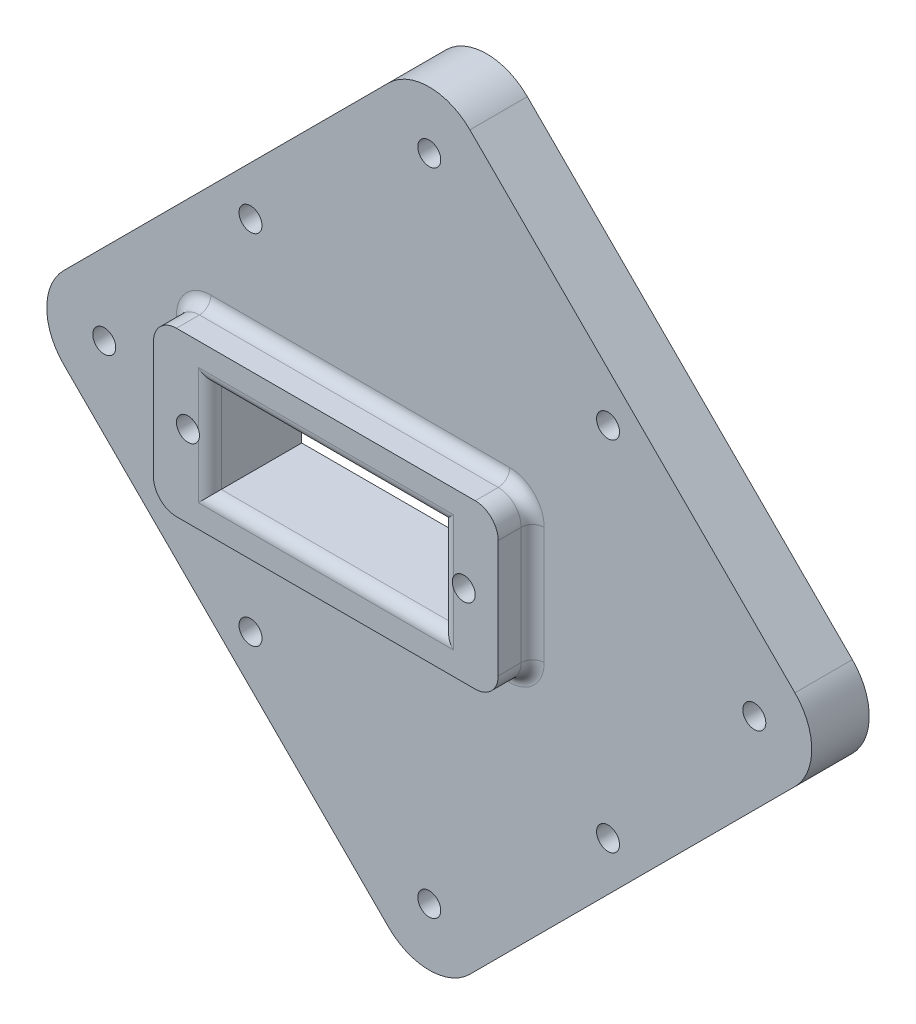
from build123d import *

# Parameters (mm, degrees)
SKETCH1_W           = 60
SKETCH1_H           = 60
BOSS_EXTRUDE1_DEPTH = 5
SKETCH2_W           = 30
SKETCH2_H           = 14.2
SKETCH2_W_2         = 20.2
SKETCH2_H_2         = 8.2
BOSS_EXTRUDE2_DEPTH = 3
SKETCH3_W           = 20.2
SKETCH3_H           = 8.2
CUT_EXTRUDE1_DEPTH  = 15
SKETCH5_R           = 1
CUT_EXTRUDE2_DEPTH  = 15
FILLET1_R           = 2
SKETCH6_W           = 120.017280655
SKETCH6_H           = 101.423054075
CUT_EXTRUDE3_DEPTH  = 15
BOSS_EXTRUDE3_DEPTH = 5
CUT_EXTRUDE4_DEPTH  = 15
FILLET3_R           = 5
SKETCH9_R           = 1
CUT_EXTRUDE5_DEPTH  = 15
SKETCH10_R          = 1
CUT_EXTRUDE6_DEPTH  = 10
FILLET4_R           = 1


with BuildPart() as part:
    # Sketch1 → Boss-Extrude1 (new body)
    with BuildSketch(Plane.XY):
        with Locations((30, 30)):
            Rectangle(SKETCH1_W, SKETCH1_H)
    extrude(amount=BOSS_EXTRUDE1_DEPTH)

    # Sketch2 → Boss-Extrude2 (add)
    with BuildSketch(Plane.XY.offset(5)):
        with Locations((24, 30)):
            Rectangle(SKETCH2_W, SKETCH2_H)
        with Locations((24, 30)):
            Rectangle(SKETCH2_W_2, SKETCH2_H_2, mode=Mode.SUBTRACT)
    extrude(amount=BOSS_EXTRUDE2_DEPTH)

    # Sketch3 → Cut-Extrude1 (cut)
    with BuildSketch(Plane.XY.offset(5)):
        with Locations((24, 30)):
            Rectangle(SKETCH3_W, SKETCH3_H)
    extrude(amount=-CUT_EXTRUDE1_DEPTH, mode=Mode.SUBTRACT)

    # Sketch5 → Cut-Extrude2 (cut)
    with BuildSketch(Plane.XY.offset(8)):
        with Locations((12, 30)):
            Circle(SKETCH5_R)
        with Locations((36, 30)):
            Circle(SKETCH5_R)
    extrude(amount=-CUT_EXTRUDE2_DEPTH, mode=Mode.SUBTRACT)

    # Fillet1
    fillet1_edges = [part.edges().sort_by_distance(p)[0] for p in [
        (39, 22.9, 6.5),
        (39, 37.1, 6.5),
        (9, 37.1, 6.5),
        (9, 22.9, 6.5),
        (0, 0, 2.5),
        (0, 60, 2.5),
        (60, 60, 2.5),
        (60, 0, 2.5),
    ]]
    fillet(fillet1_edges, radius=FILLET1_R)

    # Sketch6 → Cut-Extrude3 (cut)
    with BuildSketch(Plane(origin=(0, 0, 0), x_dir=(-1, 0, 0), z_dir=(0, 0, -1))):
        with Locations((-31.690384235, 31.655167897)):
            Rectangle(SKETCH6_W, SKETCH6_H)
        Polygon((-8.786796564, 51.213203436), (12.426406871, 30), (-30, -12.426406871), (-72.426406871, 30), (-30, 72.426406871), align=None, mode=Mode.SUBTRACT)
    extrude(amount=-CUT_EXTRUDE3_DEPTH, mode=Mode.SUBTRACT)

    # Sketch7 → Boss-Extrude3 (add)
    with BuildSketch(Plane(origin=(0, 0, 0), x_dir=(-1, 0, 0), z_dir=(0, 0, -1))):
        Polygon((-8.786796564, 51.213203436), (12.426406871, 30), (-30, -12.426406871), (-72.426406871, 30), (-30, 72.426406871), align=None)
        Polygon((-19.393398282, 40.606601718), (-8.786796564, 30), (-30, 8.786796564), (-51.213203436, 30), (-30, 51.213203436), align=None, mode=Mode.SUBTRACT)
    extrude(amount=-BOSS_EXTRUDE3_DEPTH)

    # Sketch8 → Cut-Extrude4 (cut)
    with BuildSketch(Plane(origin=(0, 0, 0), x_dir=(-1, 0, 0), z_dir=(0, 0, -1))):
        Polygon((-30, -12.426406871), (12.426406871, 30), (-30, 72.426406871), (-72.426406871, 30), align=None)
        Polygon((-30, -5.355339059), (5.355339059, 30), (-30, 65.355339059), (-65.355339059, 30), align=None, mode=Mode.SUBTRACT)
    extrude(amount=-CUT_EXTRUDE4_DEPTH, mode=Mode.SUBTRACT)

    # Fillet3
    fillet3_edges = [part.edges().sort_by_distance(p)[0] for p in [
        (65.355339059, 30, 2.5),
        (30, 65.355339059, 2.5),
        (-5.355339059, 30, 2.5),
        (30, -5.355339059, 2.5),
    ]]
    fillet(fillet3_edges, radius=FILLET3_R)

    # Sketch9 → Cut-Extrude5 (cut)
    with BuildSketch(Plane(origin=(0, 0, 0), x_dir=(-1, 0, 0), z_dir=(0, 0, -1))):
        with Locations((-30, 58.284271247)):
            Circle(SKETCH9_R)
        with Locations((-30, 1.715728753)):
            Circle(SKETCH9_R)
        with Locations((-1.715728753, 30)):
            Circle(SKETCH9_R)
        with Locations((-58.284271247, 30)):
            Circle(SKETCH9_R)
    extrude(amount=-CUT_EXTRUDE5_DEPTH, mode=Mode.SUBTRACT)

    # Sketch10 → Cut-Extrude6 (cut)
    with BuildSketch(Plane(origin=(0, 0, 0), x_dir=(-1, 0, 0), z_dir=(0, 0, -1))):
        with Locations((-45.556349186, 45.556349186)):
            Circle(SKETCH10_R)
        with Locations((-45.556349186, 14.443650814)):
            Circle(SKETCH10_R)
        with Locations((-14.443650814, 14.443650814)):
            Circle(SKETCH10_R)
        with Locations((-14.443650814, 45.556349186)):
            Circle(SKETCH10_R)
    extrude(amount=-CUT_EXTRUDE6_DEPTH, mode=Mode.SUBTRACT)

    # Fillet4
    # the kernel refuses this fillet: 1 mm, written as the material it adds along each edge
    with BuildSketch(Plane(origin=(37, 35.1, 5), x_dir=(0, 1, 0), z_dir=(-1, 0, 0))) as fillet4_piece_1:
        with BuildLine():
            CenterArc((2 + FILLET4_R, -FILLET4_R), FILLET4_R, 90, 90)
            Line((2, -FILLET4_R), (2, 0))
            Line((2, 0), (2 + FILLET4_R, 0))
        make_face()
    revolve(axis=Axis((37, 35.1, 5), (0, 0, -1)), revolution_arc=90)
    with BuildSketch(Plane(origin=(37, 22.9, 5), x_dir=(0, -1, 0), z_dir=(-1, 0, 0)), Plane(origin=(11, 37.1, 5), x_dir=(0, 1, 0), z_dir=(1, 0, 0))) as fillet4_piece_2:
        with BuildLine():
            CenterArc((FILLET4_R, FILLET4_R), FILLET4_R, 180, 90)
            Line((0, FILLET4_R), (0, 0))
            Line((0, 0), (FILLET4_R, 0))
        make_face()
    extrude(amount=26)
    with BuildSketch(Plane(origin=(9, 24.9, 5), x_dir=(-1, 0, 0), z_dir=(0, 1, 0)), Plane(origin=(39, 35.1, 5), x_dir=(1, 0, 0), z_dir=(0, -1, 0))) as fillet4_piece_3:
        with BuildLine():
            CenterArc((FILLET4_R, FILLET4_R), FILLET4_R, 180, 90)
            Line((0, FILLET4_R), (0, 0))
            Line((0, 0), (FILLET4_R, 0))
        make_face()
    extrude(amount=10.2)
    with BuildSketch(Plane(origin=(11, 24.9, 5), x_dir=(0, -1, 0), z_dir=(1, 0, 0))) as fillet4_piece_4:
        with BuildLine():
            CenterArc((2 + FILLET4_R, -FILLET4_R), FILLET4_R, 90, 90)
            Line((2, -FILLET4_R), (2, 0))
            Line((2, 0), (2 + FILLET4_R, 0))
        make_face()
    revolve(axis=Axis((11, 24.9, 5), (0, 0, -1)), revolution_arc=90)
    with BuildSketch(Plane(origin=(11, 35.1, 5), x_dir=(0, 1, 0), z_dir=(1, 0, 0))) as fillet4_piece_5:
        with BuildLine():
            CenterArc((2 + FILLET4_R, FILLET4_R), FILLET4_R, 180, 90)
            Line((2, FILLET4_R), (2, 0))
            Line((2, 0), (2 + FILLET4_R, 0))
        make_face()
    revolve(axis=Axis((11, 35.1, 5), (0, 0, 1)), revolution_arc=90)
    with BuildSketch(Plane(origin=(37, 24.9, 5), x_dir=(1, 0, 0), z_dir=(0, 1, 0))) as fillet4_piece_6:
        with BuildLine():
            CenterArc((2 + FILLET4_R, -FILLET4_R), FILLET4_R, 90, 90)
            Line((2, -FILLET4_R), (2, 0))
            Line((2, 0), (2 + FILLET4_R, 0))
        make_face()
    revolve(axis=Axis((37, 24.9, 5), (0, 0, -1)), revolution_arc=90)
    # the kernel refuses this fillet: 1 mm, written as the material it takes off along each edge
    with BuildSketch(Plane(origin=(34.1, 25.9, 8), x_dir=(0, 0, -1), z_dir=(0, 1, 0)), Plane(origin=(13.9, 34.1, 8), x_dir=(0, 0, -1), z_dir=(0, -1, 0))) as fillet4_2_piece_1:
        with BuildLine():
            CenterArc((FILLET4_R, -FILLET4_R), FILLET4_R, 90, 90)
            Line((0, -FILLET4_R), (0, 0))
            Line((0, 0), (FILLET4_R, 0))
        make_face()
    extrude(amount=8.2, mode=Mode.SUBTRACT)
    with BuildSketch(Plane(origin=(34.1, 34.1, 8), x_dir=(0, 0, -1), z_dir=(-1, 0, 0)), Plane(origin=(13.9, 25.9, 8), x_dir=(0, 0, -1), z_dir=(1, 0, 0))) as fillet4_2_piece_2:
        with BuildLine():
            CenterArc((FILLET4_R, -FILLET4_R), FILLET4_R, 90, 90)
            Line((0, -FILLET4_R), (0, 0))
            Line((0, 0), (FILLET4_R, 0))
        make_face()
    extrude(amount=20.2, mode=Mode.SUBTRACT)
    with BuildSketch(Plane(origin=(13.9, 25.9, 8), x_dir=(0, 0, -1), z_dir=(1, 0, 0))) as fillet4_2_piece_3a_section:
        with BuildLine():
            CenterArc((FILLET4_R, -FILLET4_R), FILLET4_R, 90, 90)
            Line((0, -FILLET4_R), (0, 0))
            Line((0, 0), (FILLET4_R, 0))
        make_face()
    fillet4_2_piece_3a = extrude(amount=22.7, mode=Mode.PRIVATE)
    fillet4_2_piece_3a = split(fillet4_2_piece_3a, bisect_by=Plane(origin=(34.1, 25.673604886, 7.773604886), z_dir=(1, 0, 0)), keep=Keep.TOP, mode=Mode.PRIVATE)
    with BuildSketch(Plane(origin=(34.1, 23.4, 8), x_dir=(0, 0, -1), z_dir=(0, 1, 0))) as fillet4_2_piece_3b_section:
        with BuildLine():
            CenterArc((FILLET4_R, -FILLET4_R), FILLET4_R, 90, 90)
            Line((0, -FILLET4_R), (0, 0))
            Line((0, 0), (FILLET4_R, 0))
        make_face()
    fillet4_2_piece_3b = extrude(amount=10.7, mode=Mode.PRIVATE)
    fillet4_2_piece_3b = split(fillet4_2_piece_3b, bisect_by=Plane(origin=(34.326395114, 25.9, 7.773604886), z_dir=(0, -1, 0)), keep=Keep.TOP, mode=Mode.PRIVATE)
    fillet4_2_piece_3 = fillet4_2_piece_3a & fillet4_2_piece_3b
    add(fillet4_2_piece_3, mode=Mode.SUBTRACT)
    with BuildSketch(Plane(origin=(34.1, 25.9, 8), x_dir=(0, 0, -1), z_dir=(0, 1, 0))) as fillet4_2_piece_4a_section:
        with BuildLine():
            CenterArc((FILLET4_R, -FILLET4_R), FILLET4_R, 90, 90)
            Line((0, -FILLET4_R), (0, 0))
            Line((0, 0), (FILLET4_R, 0))
        make_face()
    fillet4_2_piece_4a = extrude(amount=10.7, mode=Mode.PRIVATE)
    fillet4_2_piece_4a = split(fillet4_2_piece_4a, bisect_by=Plane(origin=(34.326395114, 34.1, 7.773604886), z_dir=(0, 1, 0)), keep=Keep.TOP, mode=Mode.PRIVATE)
    with BuildSketch(Plane(origin=(36.6, 34.1, 8), x_dir=(0, 0, -1), z_dir=(-1, 0, 0))) as fillet4_2_piece_4b_section:
        with BuildLine():
            CenterArc((FILLET4_R, -FILLET4_R), FILLET4_R, 90, 90)
            Line((0, -FILLET4_R), (0, 0))
            Line((0, 0), (FILLET4_R, 0))
        make_face()
    fillet4_2_piece_4b = extrude(amount=22.7, mode=Mode.PRIVATE)
    fillet4_2_piece_4b = split(fillet4_2_piece_4b, bisect_by=Plane(origin=(34.1, 34.326395114, 7.773604886), z_dir=(1, 0, 0)), keep=Keep.TOP, mode=Mode.PRIVATE)
    fillet4_2_piece_4 = fillet4_2_piece_4a & fillet4_2_piece_4b
    add(fillet4_2_piece_4, mode=Mode.SUBTRACT)
    with BuildSketch(Plane(origin=(13.9, 36.6, 8), x_dir=(0, 0, -1), z_dir=(0, -1, 0))) as fillet4_2_piece_5a_section:
        with BuildLine():
            CenterArc((FILLET4_R, -FILLET4_R), FILLET4_R, 90, 90)
            Line((0, -FILLET4_R), (0, 0))
            Line((0, 0), (FILLET4_R, 0))
        make_face()
    fillet4_2_piece_5a = extrude(amount=10.7, mode=Mode.PRIVATE)
    fillet4_2_piece_5a = split(fillet4_2_piece_5a, bisect_by=Plane(origin=(13.673604886, 34.1, 7.773604886), z_dir=(0, 1, 0)), keep=Keep.TOP, mode=Mode.PRIVATE)
    with BuildSketch(Plane(origin=(34.1, 34.1, 8), x_dir=(0, 0, -1), z_dir=(-1, 0, 0))) as fillet4_2_piece_5b_section:
        with BuildLine():
            CenterArc((FILLET4_R, -FILLET4_R), FILLET4_R, 90, 90)
            Line((0, -FILLET4_R), (0, 0))
            Line((0, 0), (FILLET4_R, 0))
        make_face()
    fillet4_2_piece_5b = extrude(amount=22.7, mode=Mode.PRIVATE)
    fillet4_2_piece_5b = split(fillet4_2_piece_5b, bisect_by=Plane(origin=(13.9, 34.326395114, 7.773604886), z_dir=(-1, 0, 0)), keep=Keep.TOP, mode=Mode.PRIVATE)
    fillet4_2_piece_5 = fillet4_2_piece_5a & fillet4_2_piece_5b
    add(fillet4_2_piece_5, mode=Mode.SUBTRACT)
    with BuildSketch(Plane(origin=(11.4, 25.9, 8), x_dir=(0, 0, -1), z_dir=(1, 0, 0))) as fillet4_2_piece_6a_section:
        with BuildLine():
            CenterArc((FILLET4_R, -FILLET4_R), FILLET4_R, 90, 90)
            Line((0, -FILLET4_R), (0, 0))
            Line((0, 0), (FILLET4_R, 0))
        make_face()
    fillet4_2_piece_6a = extrude(amount=22.7, mode=Mode.PRIVATE)
    fillet4_2_piece_6a = split(fillet4_2_piece_6a, bisect_by=Plane(origin=(13.9, 25.673604886, 7.773604886), z_dir=(-1, 0, 0)), keep=Keep.TOP, mode=Mode.PRIVATE)
    with BuildSketch(Plane(origin=(13.9, 34.1, 8), x_dir=(0, 0, -1), z_dir=(0, -1, 0))) as fillet4_2_piece_6b_section:
        with BuildLine():
            CenterArc((FILLET4_R, -FILLET4_R), FILLET4_R, 90, 90)
            Line((0, -FILLET4_R), (0, 0))
            Line((0, 0), (FILLET4_R, 0))
        make_face()
    fillet4_2_piece_6b = extrude(amount=10.7, mode=Mode.PRIVATE)
    fillet4_2_piece_6b = split(fillet4_2_piece_6b, bisect_by=Plane(origin=(13.673604886, 25.9, 7.773604886), z_dir=(0, -1, 0)), keep=Keep.TOP, mode=Mode.PRIVATE)
    fillet4_2_piece_6 = fillet4_2_piece_6a & fillet4_2_piece_6b
    add(fillet4_2_piece_6, mode=Mode.SUBTRACT)


solid = part.part
